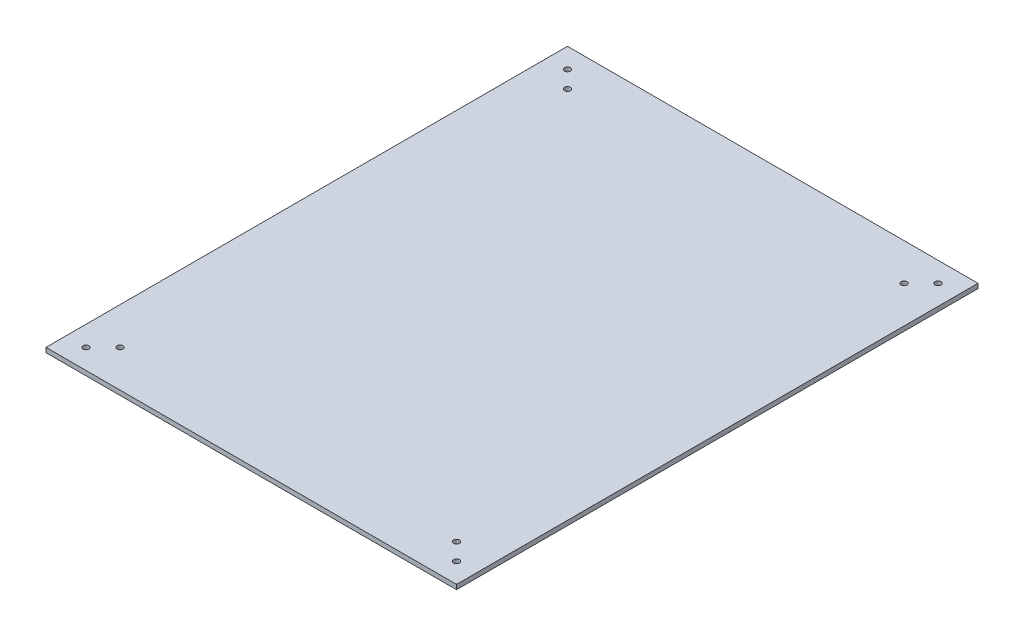
from build123d import *

# Parameters (mm, degrees)
SKETCH1_W           = 222
SKETCH1_H           = 282
SKETCH1_R           = 1.6
BOSS_EXTRUDE1_DEPTH = 2.5


with BuildPart() as part:
    # Sketch1 → Boss-Extrude1 (new body)
    with BuildSketch(Plane(origin=(0, 0, 0), x_dir=(1, 0, 0), z_dir=(0, 1, 0))):
        Rectangle(SKETCH1_W, SKETCH1_H)
        with Locations((-100.181980515, 130.181980515)):
            Circle(SKETCH1_R, mode=Mode.SUBTRACT)
        with Locations((100.181980515, 130.181980515)):
            Circle(SKETCH1_R, mode=Mode.SUBTRACT)
        with Locations((-100.181980515, -130.181980515)):
            Circle(SKETCH1_R, mode=Mode.SUBTRACT)
        with Locations((100.181980515, -130.181980515)):
            Circle(SKETCH1_R, mode=Mode.SUBTRACT)
        with Locations((-91, 121)):
            Circle(SKETCH1_R, mode=Mode.SUBTRACT)
        with Locations((91, 121)):
            Circle(SKETCH1_R, mode=Mode.SUBTRACT)
        with Locations((-91, -121)):
            Circle(SKETCH1_R, mode=Mode.SUBTRACT)
        with Locations((91, -121)):
            Circle(SKETCH1_R, mode=Mode.SUBTRACT)
    extrude(amount=BOSS_EXTRUDE1_DEPTH)


solid = part.part
